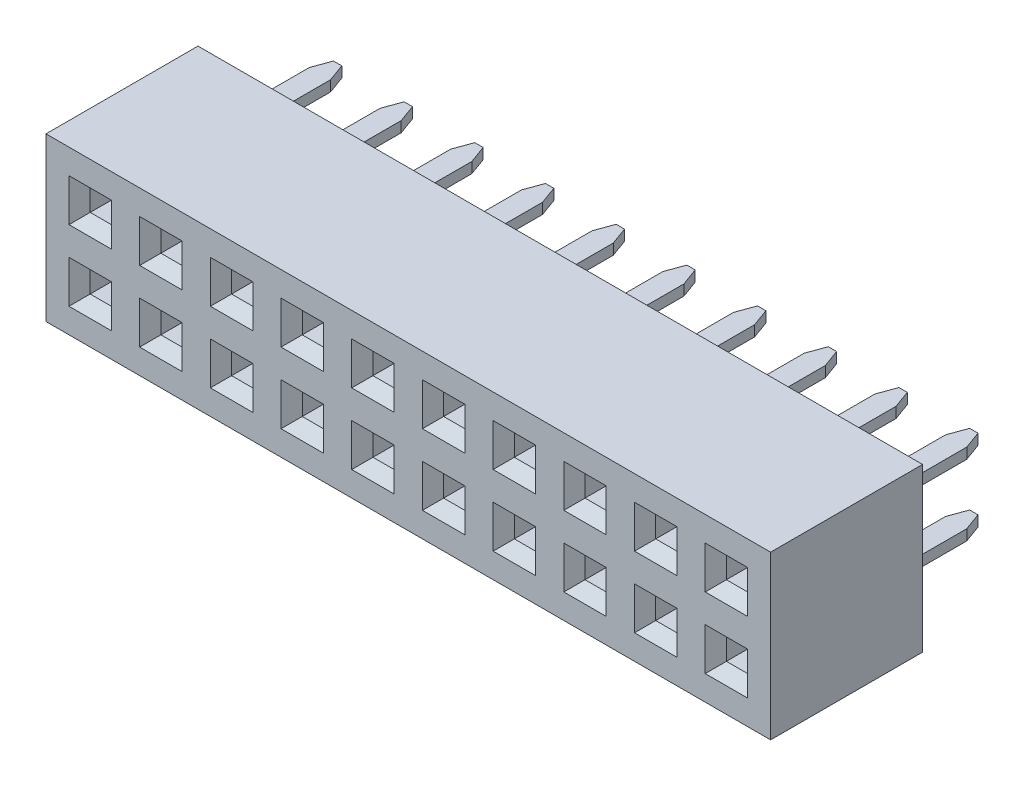
from build123d import *
from OCP.BRepFilletAPI import BRepFilletAPI_MakeChamfer

# Parameters (mm, degrees)
SKETCH_1_W                          = 20.5
SKETCH_1_H                          = 4.6
EXTRUDE_1_DEPTH                     = 4.3
SKETCH_2_W                          = 1.2
SKETCH_2_H                          = 1.2
CUT_EXTRUDE_1_DEPTH                 = 0.3
CHAMFER_1_SIZE                      = 0.3
SKETCH_3_W                          = 0.6
SKETCH_3_H                          = 0.6
CUT_EXTRUDE_2_DEPTH                 = 2.25
SKETCH_4_W                          = 0.6
SKETCH_4_H                          = 0.3
EXTRUDE_2_DEPTH                     = 2.7
CHAMFER_2_SIZE                      = 0.5
CHAMFER_2_SIZE2                     = 0.181985117
PATTERN_LINEAR_1_COUNT              = 10
PATTERN_LINEAR_1_PITCH              = 2
PATTERN_LINEAR_1_COUNT_DIR2         = 2
PATTERN_LINEAR_1_PITCH_DIR2         = 2
CHAMFER_1_OF_PATTERN_LINEAR_1_SIZE  = 0.3
PATTERN_LINEAR_2_COUNT              = 10
PATTERN_LINEAR_2_PITCH              = 2
PATTERN_LINEAR_2_COUNT_DIR2         = 2
PATTERN_LINEAR_2_PITCH_DIR2         = 2
CHAMFER_2_OF_PATTERN_LINEAR_2_SIZE  = 0.5
CHAMFER_2_OF_PATTERN_LINEAR_2_SIZE2 = 0.181985117


with BuildPart() as part:
    # Эскиз1 → Бобышка-Вытянуть1 (new body)
    with BuildSketch(Plane.XY):
        Rectangle(SKETCH_1_W, SKETCH_1_H)
    extrude(amount=EXTRUDE_1_DEPTH)

    # Эскиз2 → Вырез-Вытянуть1 (cut)
    with BuildSketch(Plane.XY.offset(4.3)):
        with Locations((9, 1)):
            Rectangle(SKETCH_2_W, SKETCH_2_H)
    cut_extrude_1 = extrude(amount=-CUT_EXTRUDE_1_DEPTH, mode=Mode.SUBTRACT)

    # Фаска1
    chamfer_1_edges = [part.edges().sort_by_distance(p)[0] for p in [
        (9, 0.4, 4),
        (9.6, 1, 4),
        (9, 1.6, 4),
        (8.4, 1, 4),
    ]]
    chamfer(chamfer_1_edges, length=CHAMFER_1_SIZE - 0.0001)  # a hair under: the kernel refuses the full size

    # Эскиз3 → Вырез-Вытянуть2 (cut)
    with BuildSketch(Plane.XY.offset(4)):
        with Locations((9, 1)):
            Rectangle(SKETCH_3_W, SKETCH_3_H)
    cut_extrude_2 = extrude(amount=-CUT_EXTRUDE_2_DEPTH, mode=Mode.SUBTRACT)

    # Эскиз4 → Бобышка-Вытянуть2 (add)
    with BuildSketch(Plane(origin=(0, 0, 0), x_dir=(-1, 0, 0), z_dir=(0, 0, -1))):
        with Locations((-9, 1)):
            Rectangle(SKETCH_4_W, SKETCH_4_H)
    extrude_2 = extrude(amount=EXTRUDE_2_DEPTH)

    # Фаска2: one chamfer whose edges measure the first distance from different faces: ONE call of the kernel's chamfer builder (chamfer() names one face for all edges)
    chamfer_2_edges_1 = [part.edges().sort_by_distance(p)[0] for p in [
        (8.7, 1, -2.7),
    ]]
    chamfer_2_side_1 = [part.faces().sort_by_distance(p)[0] for p in [
        (8.7, 1, -1.35),
    ]]
    chamfer_2_edges_2 = [part.edges().sort_by_distance(p)[0] for p in [
        (9.3, 1, -2.7),
    ]]
    chamfer_2_side_2 = [part.faces().sort_by_distance(p)[0] for p in [
        (9.3, 1, -1.35),
    ]]
    chamfer_2 = BRepFilletAPI_MakeChamfer(part.part.solid().wrapped)
    for e in chamfer_2_edges_1:
        chamfer_2.Add(CHAMFER_2_SIZE, CHAMFER_2_SIZE2, e.wrapped, chamfer_2_side_1[0].wrapped)  # the first distance lies on this face
    for e in chamfer_2_edges_2:
        chamfer_2.Add(CHAMFER_2_SIZE, CHAMFER_2_SIZE2, e.wrapped, chamfer_2_side_2[0].wrapped)  # the first distance lies on this face
    add(Compound.cast(chamfer_2.Shape()), mode=Mode.REPLACE)

    # Линейный массив1: Вырез-Вытянуть1, Cut-Extrude 2 10 × 2
    with Locations(*[(-i * PATTERN_LINEAR_1_PITCH, -j * PATTERN_LINEAR_1_PITCH_DIR2, 0) for i in range(PATTERN_LINEAR_1_COUNT) for j in range(PATTERN_LINEAR_1_COUNT_DIR2) if (i, j) != (0, 0)]):
        add(cut_extrude_1, mode=Mode.SUBTRACT)
        add(cut_extrude_2, mode=Mode.SUBTRACT)

    # Фаска1 of Линейный массив1
    chamfer_1_of_pattern_linear_1_edges = [part.edges().sort_by_distance(p)[0] for p in [
        (9, -1.6, 4),
        (9.6, -1, 4),
        (9, -0.4, 4),
        (8.4, -1, 4),
        (7, 0.4, 4),
        (7.6, 1, 4),
        (7, 1.6, 4),
        (6.4, 1, 4),
        (7, -1.6, 4),
        (7.6, -1, 4),
        (7, -0.4, 4),
        (6.4, -1, 4),
        (5, 0.4, 4),
        (5.6, 1, 4),
        (5, 1.6, 4),
        (4.4, 1, 4),
        (5, -1.6, 4),
        (5.6, -1, 4),
        (5, -0.4, 4),
        (4.4, -1, 4),
        (3, 0.4, 4),
        (3.6, 1, 4),
        (3, 1.6, 4),
        (2.4, 1, 4),
        (3, -1.6, 4),
        (3.6, -1, 4),
        (3, -0.4, 4),
        (2.4, -1, 4),
        (1, 0.4, 4),
        (1.6, 1, 4),
        (1, 1.6, 4),
        (0.4, 1, 4),
        (1, -1.6, 4),
        (1.6, -1, 4),
        (1, -0.4, 4),
        (0.4, -1, 4),
        (-1, 0.4, 4),
        (-0.4, 1, 4),
        (-1, 1.6, 4),
        (-1.6, 1, 4),
        (-1, -1.6, 4),
        (-0.4, -1, 4),
        (-1, -0.4, 4),
        (-1.6, -1, 4),
        (-3, 0.4, 4),
        (-2.4, 1, 4),
        (-3, 1.6, 4),
        (-3.6, 1, 4),
        (-3, -1.6, 4),
        (-2.4, -1, 4),
        (-3, -0.4, 4),
        (-3.6, -1, 4),
        (-5, 0.4, 4),
        (-4.4, 1, 4),
        (-5, 1.6, 4),
        (-5.6, 1, 4),
        (-5, -1.6, 4),
        (-4.4, -1, 4),
        (-5, -0.4, 4),
        (-5.6, -1, 4),
        (-7, 0.4, 4),
        (-6.4, 1, 4),
        (-7, 1.6, 4),
        (-7.6, 1, 4),
        (-7, -1.6, 4),
        (-6.4, -1, 4),
        (-7, -0.4, 4),
        (-7.6, -1, 4),
        (-9, 0.4, 4),
        (-8.4, 1, 4),
        (-9, 1.6, 4),
        (-9.6, 1, 4),
        (-9, -1.6, 4),
        (-8.4, -1, 4),
        (-9, -0.4, 4),
        (-9.6, -1, 4),
    ]]
    chamfer(chamfer_1_of_pattern_linear_1_edges, length=CHAMFER_1_OF_PATTERN_LINEAR_1_SIZE - 0.0001)  # a hair under: the kernel refuses the full size

    # Линейный массив2: Extrude 2 10 × 2
    with Locations(*[(-i * PATTERN_LINEAR_2_PITCH, -j * PATTERN_LINEAR_2_PITCH_DIR2, 0) for i in range(PATTERN_LINEAR_2_COUNT) for j in range(PATTERN_LINEAR_2_COUNT_DIR2) if (i, j) != (0, 0)]):
        add(extrude_2)

    # Фаска2 of Линейный массив2: one chamfer whose edges measure the first distance from different faces: ONE call of the kernel's chamfer builder (chamfer() names one face for all edges)
    chamfer_2_of_pattern_linear_2_edges_1 = [part.edges().sort_by_distance(p)[0] for p in [
        (8.7, -1, -2.7),
    ]]
    chamfer_2_of_pattern_linear_2_side_1 = [part.faces().sort_by_distance(p)[0] for p in [
        (8.7, -1, -1.35),
    ]]
    chamfer_2_of_pattern_linear_2_edges_2 = [part.edges().sort_by_distance(p)[0] for p in [
        (9.3, -1, -2.7),
    ]]
    chamfer_2_of_pattern_linear_2_side_2 = [part.faces().sort_by_distance(p)[0] for p in [
        (9.3, -1, -1.35),
    ]]
    chamfer_2_of_pattern_linear_2_edges_3 = [part.edges().sort_by_distance(p)[0] for p in [
        (6.7, 1, -2.7),
    ]]
    chamfer_2_of_pattern_linear_2_side_3 = [part.faces().sort_by_distance(p)[0] for p in [
        (6.7, 1, -1.35),
    ]]
    chamfer_2_of_pattern_linear_2_edges_4 = [part.edges().sort_by_distance(p)[0] for p in [
        (7.3, 1, -2.7),
    ]]
    chamfer_2_of_pattern_linear_2_side_4 = [part.faces().sort_by_distance(p)[0] for p in [
        (7.3, 1, -1.35),
    ]]
    chamfer_2_of_pattern_linear_2_edges_5 = [part.edges().sort_by_distance(p)[0] for p in [
        (6.7, -1, -2.7),
    ]]
    chamfer_2_of_pattern_linear_2_side_5 = [part.faces().sort_by_distance(p)[0] for p in [
        (6.7, -1, -1.35),
    ]]
    chamfer_2_of_pattern_linear_2_edges_6 = [part.edges().sort_by_distance(p)[0] for p in [
        (7.3, -1, -2.7),
    ]]
    chamfer_2_of_pattern_linear_2_side_6 = [part.faces().sort_by_distance(p)[0] for p in [
        (7.3, -1, -1.35),
    ]]
    chamfer_2_of_pattern_linear_2_edges_7 = [part.edges().sort_by_distance(p)[0] for p in [
        (4.7, 1, -2.7),
    ]]
    chamfer_2_of_pattern_linear_2_side_7 = [part.faces().sort_by_distance(p)[0] for p in [
        (4.7, 1, -1.35),
    ]]
    chamfer_2_of_pattern_linear_2_edges_8 = [part.edges().sort_by_distance(p)[0] for p in [
        (5.3, 1, -2.7),
    ]]
    chamfer_2_of_pattern_linear_2_side_8 = [part.faces().sort_by_distance(p)[0] for p in [
        (5.3, 1, -1.35),
    ]]
    chamfer_2_of_pattern_linear_2_edges_9 = [part.edges().sort_by_distance(p)[0] for p in [
        (4.7, -1, -2.7),
    ]]
    chamfer_2_of_pattern_linear_2_side_9 = [part.faces().sort_by_distance(p)[0] for p in [
        (4.7, -1, -1.35),
    ]]
    chamfer_2_of_pattern_linear_2_edges_10 = [part.edges().sort_by_distance(p)[0] for p in [
        (5.3, -1, -2.7),
    ]]
    chamfer_2_of_pattern_linear_2_side_10 = [part.faces().sort_by_distance(p)[0] for p in [
        (5.3, -1, -1.35),
    ]]
    chamfer_2_of_pattern_linear_2_edges_11 = [part.edges().sort_by_distance(p)[0] for p in [
        (2.7, 1, -2.7),
    ]]
    chamfer_2_of_pattern_linear_2_side_11 = [part.faces().sort_by_distance(p)[0] for p in [
        (2.7, 1, -1.35),
    ]]
    chamfer_2_of_pattern_linear_2_edges_12 = [part.edges().sort_by_distance(p)[0] for p in [
        (3.3, 1, -2.7),
    ]]
    chamfer_2_of_pattern_linear_2_side_12 = [part.faces().sort_by_distance(p)[0] for p in [
        (3.3, 1, -1.35),
    ]]
    chamfer_2_of_pattern_linear_2_edges_13 = [part.edges().sort_by_distance(p)[0] for p in [
        (2.7, -1, -2.7),
    ]]
    chamfer_2_of_pattern_linear_2_side_13 = [part.faces().sort_by_distance(p)[0] for p in [
        (2.7, -1, -1.35),
    ]]
    chamfer_2_of_pattern_linear_2_edges_14 = [part.edges().sort_by_distance(p)[0] for p in [
        (3.3, -1, -2.7),
    ]]
    chamfer_2_of_pattern_linear_2_side_14 = [part.faces().sort_by_distance(p)[0] for p in [
        (3.3, -1, -1.35),
    ]]
    chamfer_2_of_pattern_linear_2_edges_15 = [part.edges().sort_by_distance(p)[0] for p in [
        (0.7, 1, -2.7),
    ]]
    chamfer_2_of_pattern_linear_2_side_15 = [part.faces().sort_by_distance(p)[0] for p in [
        (0.7, 1, -1.35),
    ]]
    chamfer_2_of_pattern_linear_2_edges_16 = [part.edges().sort_by_distance(p)[0] for p in [
        (1.3, 1, -2.7),
    ]]
    chamfer_2_of_pattern_linear_2_side_16 = [part.faces().sort_by_distance(p)[0] for p in [
        (1.3, 1, -1.35),
    ]]
    chamfer_2_of_pattern_linear_2_edges_17 = [part.edges().sort_by_distance(p)[0] for p in [
        (0.7, -1, -2.7),
    ]]
    chamfer_2_of_pattern_linear_2_side_17 = [part.faces().sort_by_distance(p)[0] for p in [
        (0.7, -1, -1.35),
    ]]
    chamfer_2_of_pattern_linear_2_edges_18 = [part.edges().sort_by_distance(p)[0] for p in [
        (1.3, -1, -2.7),
    ]]
    chamfer_2_of_pattern_linear_2_side_18 = [part.faces().sort_by_distance(p)[0] for p in [
        (1.3, -1, -1.35),
    ]]
    chamfer_2_of_pattern_linear_2_edges_19 = [part.edges().sort_by_distance(p)[0] for p in [
        (-1.3, 1, -2.7),
    ]]
    chamfer_2_of_pattern_linear_2_side_19 = [part.faces().sort_by_distance(p)[0] for p in [
        (-1.3, 1, -1.35),
    ]]
    chamfer_2_of_pattern_linear_2_edges_20 = [part.edges().sort_by_distance(p)[0] for p in [
        (-0.7, 1, -2.7),
    ]]
    chamfer_2_of_pattern_linear_2_side_20 = [part.faces().sort_by_distance(p)[0] for p in [
        (-0.7, 1, -1.35),
    ]]
    chamfer_2_of_pattern_linear_2_edges_21 = [part.edges().sort_by_distance(p)[0] for p in [
        (-1.3, -1, -2.7),
    ]]
    chamfer_2_of_pattern_linear_2_side_21 = [part.faces().sort_by_distance(p)[0] for p in [
        (-1.3, -1, -1.35),
    ]]
    chamfer_2_of_pattern_linear_2_edges_22 = [part.edges().sort_by_distance(p)[0] for p in [
        (-0.7, -1, -2.7),
    ]]
    chamfer_2_of_pattern_linear_2_side_22 = [part.faces().sort_by_distance(p)[0] for p in [
        (-0.7, -1, -1.35),
    ]]
    chamfer_2_of_pattern_linear_2_edges_23 = [part.edges().sort_by_distance(p)[0] for p in [
        (-3.3, 1, -2.7),
    ]]
    chamfer_2_of_pattern_linear_2_side_23 = [part.faces().sort_by_distance(p)[0] for p in [
        (-3.3, 1, -1.35),
    ]]
    chamfer_2_of_pattern_linear_2_edges_24 = [part.edges().sort_by_distance(p)[0] for p in [
        (-2.7, 1, -2.7),
    ]]
    chamfer_2_of_pattern_linear_2_side_24 = [part.faces().sort_by_distance(p)[0] for p in [
        (-2.7, 1, -1.35),
    ]]
    chamfer_2_of_pattern_linear_2_edges_25 = [part.edges().sort_by_distance(p)[0] for p in [
        (-3.3, -1, -2.7),
    ]]
    chamfer_2_of_pattern_linear_2_side_25 = [part.faces().sort_by_distance(p)[0] for p in [
        (-3.3, -1, -1.35),
    ]]
    chamfer_2_of_pattern_linear_2_edges_26 = [part.edges().sort_by_distance(p)[0] for p in [
        (-2.7, -1, -2.7),
    ]]
    chamfer_2_of_pattern_linear_2_side_26 = [part.faces().sort_by_distance(p)[0] for p in [
        (-2.7, -1, -1.35),
    ]]
    chamfer_2_of_pattern_linear_2_edges_27 = [part.edges().sort_by_distance(p)[0] for p in [
        (-5.3, 1, -2.7),
    ]]
    chamfer_2_of_pattern_linear_2_side_27 = [part.faces().sort_by_distance(p)[0] for p in [
        (-5.3, 1, -1.35),
    ]]
    chamfer_2_of_pattern_linear_2_edges_28 = [part.edges().sort_by_distance(p)[0] for p in [
        (-4.7, 1, -2.7),
    ]]
    chamfer_2_of_pattern_linear_2_side_28 = [part.faces().sort_by_distance(p)[0] for p in [
        (-4.7, 1, -1.35),
    ]]
    chamfer_2_of_pattern_linear_2_edges_29 = [part.edges().sort_by_distance(p)[0] for p in [
        (-5.3, -1, -2.7),
    ]]
    chamfer_2_of_pattern_linear_2_side_29 = [part.faces().sort_by_distance(p)[0] for p in [
        (-5.3, -1, -1.35),
    ]]
    chamfer_2_of_pattern_linear_2_edges_30 = [part.edges().sort_by_distance(p)[0] for p in [
        (-4.7, -1, -2.7),
    ]]
    chamfer_2_of_pattern_linear_2_side_30 = [part.faces().sort_by_distance(p)[0] for p in [
        (-4.7, -1, -1.35),
    ]]
    chamfer_2_of_pattern_linear_2_edges_31 = [part.edges().sort_by_distance(p)[0] for p in [
        (-7.3, 1, -2.7),
    ]]
    chamfer_2_of_pattern_linear_2_side_31 = [part.faces().sort_by_distance(p)[0] for p in [
        (-7.3, 1, -1.35),
    ]]
    chamfer_2_of_pattern_linear_2_edges_32 = [part.edges().sort_by_distance(p)[0] for p in [
        (-6.7, 1, -2.7),
    ]]
    chamfer_2_of_pattern_linear_2_side_32 = [part.faces().sort_by_distance(p)[0] for p in [
        (-6.7, 1, -1.35),
    ]]
    chamfer_2_of_pattern_linear_2_edges_33 = [part.edges().sort_by_distance(p)[0] for p in [
        (-7.3, -1, -2.7),
    ]]
    chamfer_2_of_pattern_linear_2_side_33 = [part.faces().sort_by_distance(p)[0] for p in [
        (-7.3, -1, -1.35),
    ]]
    chamfer_2_of_pattern_linear_2_edges_34 = [part.edges().sort_by_distance(p)[0] for p in [
        (-6.7, -1, -2.7),
    ]]
    chamfer_2_of_pattern_linear_2_side_34 = [part.faces().sort_by_distance(p)[0] for p in [
        (-6.7, -1, -1.35),
    ]]
    chamfer_2_of_pattern_linear_2_edges_35 = [part.edges().sort_by_distance(p)[0] for p in [
        (-9.3, 1, -2.7),
    ]]
    chamfer_2_of_pattern_linear_2_side_35 = [part.faces().sort_by_distance(p)[0] for p in [
        (-9.3, 1, -1.35),
    ]]
    chamfer_2_of_pattern_linear_2_edges_36 = [part.edges().sort_by_distance(p)[0] for p in [
        (-8.7, 1, -2.7),
    ]]
    chamfer_2_of_pattern_linear_2_side_36 = [part.faces().sort_by_distance(p)[0] for p in [
        (-8.7, 1, -1.35),
    ]]
    chamfer_2_of_pattern_linear_2_edges_37 = [part.edges().sort_by_distance(p)[0] for p in [
        (-9.3, -1, -2.7),
    ]]
    chamfer_2_of_pattern_linear_2_side_37 = [part.faces().sort_by_distance(p)[0] for p in [
        (-9.3, -1, -1.35),
    ]]
    chamfer_2_of_pattern_linear_2_edges_38 = [part.edges().sort_by_distance(p)[0] for p in [
        (-8.7, -1, -2.7),
    ]]
    chamfer_2_of_pattern_linear_2_side_38 = [part.faces().sort_by_distance(p)[0] for p in [
        (-8.7, -1, -1.35),
    ]]
    chamfer_2_of_pattern_linear_2 = BRepFilletAPI_MakeChamfer(part.part.solid().wrapped)
    for e in chamfer_2_of_pattern_linear_2_edges_1:
        chamfer_2_of_pattern_linear_2.Add(CHAMFER_2_OF_PATTERN_LINEAR_2_SIZE, CHAMFER_2_OF_PATTERN_LINEAR_2_SIZE2, e.wrapped, chamfer_2_of_pattern_linear_2_side_1[0].wrapped)  # the first distance lies on this face
    for e in chamfer_2_of_pattern_linear_2_edges_2:
        chamfer_2_of_pattern_linear_2.Add(CHAMFER_2_OF_PATTERN_LINEAR_2_SIZE, CHAMFER_2_OF_PATTERN_LINEAR_2_SIZE2, e.wrapped, chamfer_2_of_pattern_linear_2_side_2[0].wrapped)  # the first distance lies on this face
    for e in chamfer_2_of_pattern_linear_2_edges_3:
        chamfer_2_of_pattern_linear_2.Add(CHAMFER_2_OF_PATTERN_LINEAR_2_SIZE, CHAMFER_2_OF_PATTERN_LINEAR_2_SIZE2, e.wrapped, chamfer_2_of_pattern_linear_2_side_3[0].wrapped)  # the first distance lies on this face
    for e in chamfer_2_of_pattern_linear_2_edges_4:
        chamfer_2_of_pattern_linear_2.Add(CHAMFER_2_OF_PATTERN_LINEAR_2_SIZE, CHAMFER_2_OF_PATTERN_LINEAR_2_SIZE2, e.wrapped, chamfer_2_of_pattern_linear_2_side_4[0].wrapped)  # the first distance lies on this face
    for e in chamfer_2_of_pattern_linear_2_edges_5:
        chamfer_2_of_pattern_linear_2.Add(CHAMFER_2_OF_PATTERN_LINEAR_2_SIZE, CHAMFER_2_OF_PATTERN_LINEAR_2_SIZE2, e.wrapped, chamfer_2_of_pattern_linear_2_side_5[0].wrapped)  # the first distance lies on this face
    for e in chamfer_2_of_pattern_linear_2_edges_6:
        chamfer_2_of_pattern_linear_2.Add(CHAMFER_2_OF_PATTERN_LINEAR_2_SIZE, CHAMFER_2_OF_PATTERN_LINEAR_2_SIZE2, e.wrapped, chamfer_2_of_pattern_linear_2_side_6[0].wrapped)  # the first distance lies on this face
    for e in chamfer_2_of_pattern_linear_2_edges_7:
        chamfer_2_of_pattern_linear_2.Add(CHAMFER_2_OF_PATTERN_LINEAR_2_SIZE, CHAMFER_2_OF_PATTERN_LINEAR_2_SIZE2, e.wrapped, chamfer_2_of_pattern_linear_2_side_7[0].wrapped)  # the first distance lies on this face
    for e in chamfer_2_of_pattern_linear_2_edges_8:
        chamfer_2_of_pattern_linear_2.Add(CHAMFER_2_OF_PATTERN_LINEAR_2_SIZE, CHAMFER_2_OF_PATTERN_LINEAR_2_SIZE2, e.wrapped, chamfer_2_of_pattern_linear_2_side_8[0].wrapped)  # the first distance lies on this face
    for e in chamfer_2_of_pattern_linear_2_edges_9:
        chamfer_2_of_pattern_linear_2.Add(CHAMFER_2_OF_PATTERN_LINEAR_2_SIZE, CHAMFER_2_OF_PATTERN_LINEAR_2_SIZE2, e.wrapped, chamfer_2_of_pattern_linear_2_side_9[0].wrapped)  # the first distance lies on this face
    for e in chamfer_2_of_pattern_linear_2_edges_10:
        chamfer_2_of_pattern_linear_2.Add(CHAMFER_2_OF_PATTERN_LINEAR_2_SIZE, CHAMFER_2_OF_PATTERN_LINEAR_2_SIZE2, e.wrapped, chamfer_2_of_pattern_linear_2_side_10[0].wrapped)  # the first distance lies on this face
    for e in chamfer_2_of_pattern_linear_2_edges_11:
        chamfer_2_of_pattern_linear_2.Add(CHAMFER_2_OF_PATTERN_LINEAR_2_SIZE, CHAMFER_2_OF_PATTERN_LINEAR_2_SIZE2, e.wrapped, chamfer_2_of_pattern_linear_2_side_11[0].wrapped)  # the first distance lies on this face
    for e in chamfer_2_of_pattern_linear_2_edges_12:
        chamfer_2_of_pattern_linear_2.Add(CHAMFER_2_OF_PATTERN_LINEAR_2_SIZE, CHAMFER_2_OF_PATTERN_LINEAR_2_SIZE2, e.wrapped, chamfer_2_of_pattern_linear_2_side_12[0].wrapped)  # the first distance lies on this face
    for e in chamfer_2_of_pattern_linear_2_edges_13:
        chamfer_2_of_pattern_linear_2.Add(CHAMFER_2_OF_PATTERN_LINEAR_2_SIZE, CHAMFER_2_OF_PATTERN_LINEAR_2_SIZE2, e.wrapped, chamfer_2_of_pattern_linear_2_side_13[0].wrapped)  # the first distance lies on this face
    for e in chamfer_2_of_pattern_linear_2_edges_14:
        chamfer_2_of_pattern_linear_2.Add(CHAMFER_2_OF_PATTERN_LINEAR_2_SIZE, CHAMFER_2_OF_PATTERN_LINEAR_2_SIZE2, e.wrapped, chamfer_2_of_pattern_linear_2_side_14[0].wrapped)  # the first distance lies on this face
    for e in chamfer_2_of_pattern_linear_2_edges_15:
        chamfer_2_of_pattern_linear_2.Add(CHAMFER_2_OF_PATTERN_LINEAR_2_SIZE, CHAMFER_2_OF_PATTERN_LINEAR_2_SIZE2, e.wrapped, chamfer_2_of_pattern_linear_2_side_15[0].wrapped)  # the first distance lies on this face
    for e in chamfer_2_of_pattern_linear_2_edges_16:
        chamfer_2_of_pattern_linear_2.Add(CHAMFER_2_OF_PATTERN_LINEAR_2_SIZE, CHAMFER_2_OF_PATTERN_LINEAR_2_SIZE2, e.wrapped, chamfer_2_of_pattern_linear_2_side_16[0].wrapped)  # the first distance lies on this face
    for e in chamfer_2_of_pattern_linear_2_edges_17:
        chamfer_2_of_pattern_linear_2.Add(CHAMFER_2_OF_PATTERN_LINEAR_2_SIZE, CHAMFER_2_OF_PATTERN_LINEAR_2_SIZE2, e.wrapped, chamfer_2_of_pattern_linear_2_side_17[0].wrapped)  # the first distance lies on this face
    for e in chamfer_2_of_pattern_linear_2_edges_18:
        chamfer_2_of_pattern_linear_2.Add(CHAMFER_2_OF_PATTERN_LINEAR_2_SIZE, CHAMFER_2_OF_PATTERN_LINEAR_2_SIZE2, e.wrapped, chamfer_2_of_pattern_linear_2_side_18[0].wrapped)  # the first distance lies on this face
    for e in chamfer_2_of_pattern_linear_2_edges_19:
        chamfer_2_of_pattern_linear_2.Add(CHAMFER_2_OF_PATTERN_LINEAR_2_SIZE, CHAMFER_2_OF_PATTERN_LINEAR_2_SIZE2, e.wrapped, chamfer_2_of_pattern_linear_2_side_19[0].wrapped)  # the first distance lies on this face
    for e in chamfer_2_of_pattern_linear_2_edges_20:
        chamfer_2_of_pattern_linear_2.Add(CHAMFER_2_OF_PATTERN_LINEAR_2_SIZE, CHAMFER_2_OF_PATTERN_LINEAR_2_SIZE2, e.wrapped, chamfer_2_of_pattern_linear_2_side_20[0].wrapped)  # the first distance lies on this face
    for e in chamfer_2_of_pattern_linear_2_edges_21:
        chamfer_2_of_pattern_linear_2.Add(CHAMFER_2_OF_PATTERN_LINEAR_2_SIZE, CHAMFER_2_OF_PATTERN_LINEAR_2_SIZE2, e.wrapped, chamfer_2_of_pattern_linear_2_side_21[0].wrapped)  # the first distance lies on this face
    for e in chamfer_2_of_pattern_linear_2_edges_22:
        chamfer_2_of_pattern_linear_2.Add(CHAMFER_2_OF_PATTERN_LINEAR_2_SIZE, CHAMFER_2_OF_PATTERN_LINEAR_2_SIZE2, e.wrapped, chamfer_2_of_pattern_linear_2_side_22[0].wrapped)  # the first distance lies on this face
    for e in chamfer_2_of_pattern_linear_2_edges_23:
        chamfer_2_of_pattern_linear_2.Add(CHAMFER_2_OF_PATTERN_LINEAR_2_SIZE, CHAMFER_2_OF_PATTERN_LINEAR_2_SIZE2, e.wrapped, chamfer_2_of_pattern_linear_2_side_23[0].wrapped)  # the first distance lies on this face
    for e in chamfer_2_of_pattern_linear_2_edges_24:
        chamfer_2_of_pattern_linear_2.Add(CHAMFER_2_OF_PATTERN_LINEAR_2_SIZE, CHAMFER_2_OF_PATTERN_LINEAR_2_SIZE2, e.wrapped, chamfer_2_of_pattern_linear_2_side_24[0].wrapped)  # the first distance lies on this face
    for e in chamfer_2_of_pattern_linear_2_edges_25:
        chamfer_2_of_pattern_linear_2.Add(CHAMFER_2_OF_PATTERN_LINEAR_2_SIZE, CHAMFER_2_OF_PATTERN_LINEAR_2_SIZE2, e.wrapped, chamfer_2_of_pattern_linear_2_side_25[0].wrapped)  # the first distance lies on this face
    for e in chamfer_2_of_pattern_linear_2_edges_26:
        chamfer_2_of_pattern_linear_2.Add(CHAMFER_2_OF_PATTERN_LINEAR_2_SIZE, CHAMFER_2_OF_PATTERN_LINEAR_2_SIZE2, e.wrapped, chamfer_2_of_pattern_linear_2_side_26[0].wrapped)  # the first distance lies on this face
    for e in chamfer_2_of_pattern_linear_2_edges_27:
        chamfer_2_of_pattern_linear_2.Add(CHAMFER_2_OF_PATTERN_LINEAR_2_SIZE, CHAMFER_2_OF_PATTERN_LINEAR_2_SIZE2, e.wrapped, chamfer_2_of_pattern_linear_2_side_27[0].wrapped)  # the first distance lies on this face
    for e in chamfer_2_of_pattern_linear_2_edges_28:
        chamfer_2_of_pattern_linear_2.Add(CHAMFER_2_OF_PATTERN_LINEAR_2_SIZE, CHAMFER_2_OF_PATTERN_LINEAR_2_SIZE2, e.wrapped, chamfer_2_of_pattern_linear_2_side_28[0].wrapped)  # the first distance lies on this face
    for e in chamfer_2_of_pattern_linear_2_edges_29:
        chamfer_2_of_pattern_linear_2.Add(CHAMFER_2_OF_PATTERN_LINEAR_2_SIZE, CHAMFER_2_OF_PATTERN_LINEAR_2_SIZE2, e.wrapped, chamfer_2_of_pattern_linear_2_side_29[0].wrapped)  # the first distance lies on this face
    for e in chamfer_2_of_pattern_linear_2_edges_30:
        chamfer_2_of_pattern_linear_2.Add(CHAMFER_2_OF_PATTERN_LINEAR_2_SIZE, CHAMFER_2_OF_PATTERN_LINEAR_2_SIZE2, e.wrapped, chamfer_2_of_pattern_linear_2_side_30[0].wrapped)  # the first distance lies on this face
    for e in chamfer_2_of_pattern_linear_2_edges_31:
        chamfer_2_of_pattern_linear_2.Add(CHAMFER_2_OF_PATTERN_LINEAR_2_SIZE, CHAMFER_2_OF_PATTERN_LINEAR_2_SIZE2, e.wrapped, chamfer_2_of_pattern_linear_2_side_31[0].wrapped)  # the first distance lies on this face
    for e in chamfer_2_of_pattern_linear_2_edges_32:
        chamfer_2_of_pattern_linear_2.Add(CHAMFER_2_OF_PATTERN_LINEAR_2_SIZE, CHAMFER_2_OF_PATTERN_LINEAR_2_SIZE2, e.wrapped, chamfer_2_of_pattern_linear_2_side_32[0].wrapped)  # the first distance lies on this face
    for e in chamfer_2_of_pattern_linear_2_edges_33:
        chamfer_2_of_pattern_linear_2.Add(CHAMFER_2_OF_PATTERN_LINEAR_2_SIZE, CHAMFER_2_OF_PATTERN_LINEAR_2_SIZE2, e.wrapped, chamfer_2_of_pattern_linear_2_side_33[0].wrapped)  # the first distance lies on this face
    for e in chamfer_2_of_pattern_linear_2_edges_34:
        chamfer_2_of_pattern_linear_2.Add(CHAMFER_2_OF_PATTERN_LINEAR_2_SIZE, CHAMFER_2_OF_PATTERN_LINEAR_2_SIZE2, e.wrapped, chamfer_2_of_pattern_linear_2_side_34[0].wrapped)  # the first distance lies on this face
    for e in chamfer_2_of_pattern_linear_2_edges_35:
        chamfer_2_of_pattern_linear_2.Add(CHAMFER_2_OF_PATTERN_LINEAR_2_SIZE, CHAMFER_2_OF_PATTERN_LINEAR_2_SIZE2, e.wrapped, chamfer_2_of_pattern_linear_2_side_35[0].wrapped)  # the first distance lies on this face
    for e in chamfer_2_of_pattern_linear_2_edges_36:
        chamfer_2_of_pattern_linear_2.Add(CHAMFER_2_OF_PATTERN_LINEAR_2_SIZE, CHAMFER_2_OF_PATTERN_LINEAR_2_SIZE2, e.wrapped, chamfer_2_of_pattern_linear_2_side_36[0].wrapped)  # the first distance lies on this face
    for e in chamfer_2_of_pattern_linear_2_edges_37:
        chamfer_2_of_pattern_linear_2.Add(CHAMFER_2_OF_PATTERN_LINEAR_2_SIZE, CHAMFER_2_OF_PATTERN_LINEAR_2_SIZE2, e.wrapped, chamfer_2_of_pattern_linear_2_side_37[0].wrapped)  # the first distance lies on this face
    for e in chamfer_2_of_pattern_linear_2_edges_38:
        chamfer_2_of_pattern_linear_2.Add(CHAMFER_2_OF_PATTERN_LINEAR_2_SIZE, CHAMFER_2_OF_PATTERN_LINEAR_2_SIZE2, e.wrapped, chamfer_2_of_pattern_linear_2_side_38[0].wrapped)  # the first distance lies on this face
    add(Compound.cast(chamfer_2_of_pattern_linear_2.Shape()), mode=Mode.REPLACE)


solid = part.part
